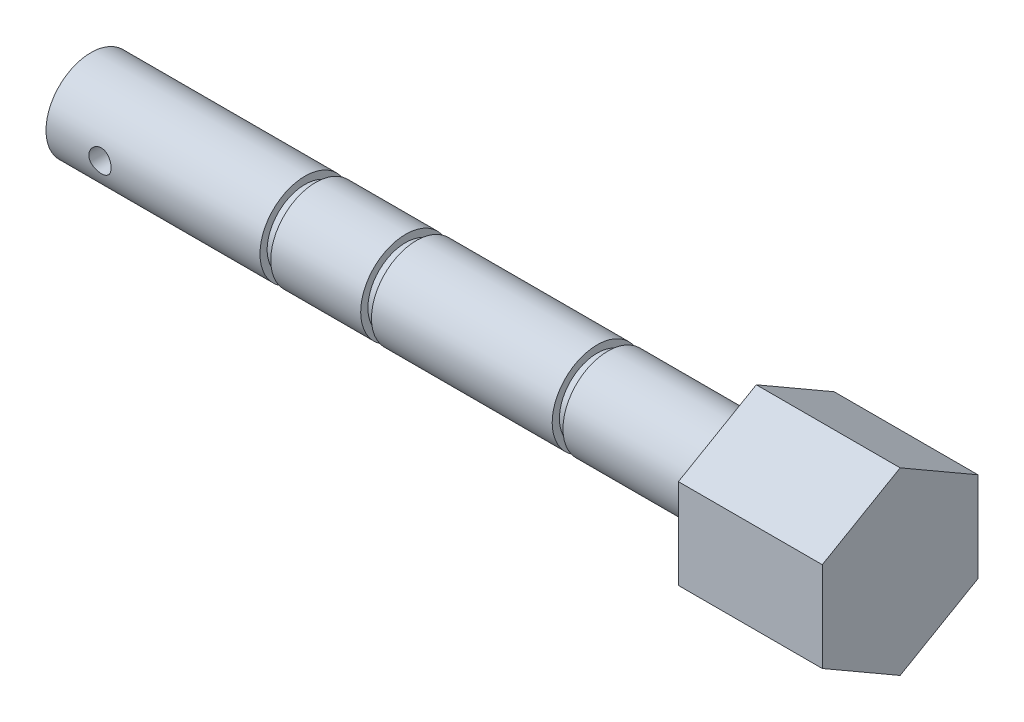
from build123d import *

# Parameters (mm, degrees)
SKETCH1_R           = 3.175
BOSS_EXTRUDE2_DEPTH = 46.99
BOSS_EXTRUDE3_DEPTH = 10.16
SKETCH3_R           = 3.175
SKETCH3_R_2         = 1.778
CUT_EXTRUDE1_DEPTH  = 19.05
SKETCH6_R           = 3.175
BOSS_EXTRUDE5_DEPTH = 49.022
CUT_EXTRUDE5_DEPTH  = 38.1
SKETCH9_R           = 0.866025404
CUT_EXTRUDE7_DEPTH  = 46.99
SKETCH10_R          = 0.7874
CUT_EXTRUDE8_DEPTH  = 5.334
CUT_EXTRUDE9_START  = 0.762
SKETCH11_R          = 3.175
SKETCH11_R_2        = 2.667
CUT_EXTRUDE9_DEPTH  = 0.762
CUT_EXTRUDE10_START = 0.762
SKETCH12_R          = 3.175
SKETCH12_R_2        = 2.667
CUT_EXTRUDE10_DEPTH = 0.762
CUT_EXTRUDE12_START = 0.762
SKETCH13_R          = 3.175
SKETCH13_R_2        = 2.667
CUT_EXTRUDE12_DEPTH = 0.762


with BuildPart() as part:
    # Sketch1 → Boss-Extrude2 (new body)
    with BuildSketch(Plane(origin=(0, 0, 0), x_dir=(0, 0, -1), z_dir=(1, 0, 0))):
        Circle(SKETCH1_R)
    extrude(amount=BOSS_EXTRUDE2_DEPTH)

    # Sketch2 → Boss-Extrude3 (add)
    with BuildSketch(Plane(origin=(46.99, 0, 0), x_dir=(0, 0, -1), z_dir=(1, 0, 0))):
        Polygon((-5.499261314, 3.175), (-5.499261314, -3.175), (0, -6.35), (5.499261314, -3.175), (5.499261314, 3.175), (0, 6.35), align=None)
    extrude(amount=BOSS_EXTRUDE3_DEPTH)

    # Sketch3 → Cut-Extrude1 (cut)
    with BuildSketch(Plane.ZY):
        Circle(SKETCH3_R)
        Circle(SKETCH3_R_2, mode=Mode.SUBTRACT)
    extrude(amount=-CUT_EXTRUDE1_DEPTH, mode=Mode.SUBTRACT)

    # Sketch6 → Boss-Extrude5 (add)
    with BuildSketch(Plane.ZY):
        Circle(SKETCH6_R)
    extrude(amount=-BOSS_EXTRUDE5_DEPTH)

    # Sketch7 → Cut-Extrude5 (cut)
    with BuildSketch(Plane.ZY):
        Polygon((-0.489261374, 0.714579112), (-0.863474351, -0.066423223), (-0.374212977, -0.781002335), (0.489261374, -0.714579112), (0.863474351, 0.066423223), (0.374212977, 0.781002335), align=None)
    extrude(amount=-CUT_EXTRUDE5_DEPTH, mode=Mode.SUBTRACT)

    # Sketch9 → Cut-Extrude7 (cut)
    with BuildSketch(Plane.ZY):
        Circle(SKETCH9_R)
    extrude(amount=-CUT_EXTRUDE7_DEPTH, mode=Mode.SUBTRACT)

    # Sketch10 → Cut-Extrude8 (cut)
    with BuildSketch(Plane.XY.offset(5.499261314)):
        with Locations((3.81, 0)):
            Circle(SKETCH10_R)
    extrude(amount=-CUT_EXTRUDE8_DEPTH, mode=Mode.SUBTRACT)

    # Sketch11 → Cut-Extrude9 (cut)
    with BuildSketch(Plane.ZY.offset(-36.5125).offset(CUT_EXTRUDE9_START)):
        Circle(SKETCH11_R)
        Circle(SKETCH11_R_2, mode=Mode.SUBTRACT)
    extrude(amount=-CUT_EXTRUDE9_DEPTH, mode=Mode.SUBTRACT)

    # Sketch12 → Cut-Extrude10 (cut)
    with BuildSketch(Plane.ZY.offset(-15.875).offset(CUT_EXTRUDE10_START)):
        Circle(SKETCH12_R)
        Circle(SKETCH12_R_2, mode=Mode.SUBTRACT)
    extrude(amount=-CUT_EXTRUDE10_DEPTH, mode=Mode.SUBTRACT)

    # Sketch13 → Cut-Extrude12 (cut)
    with BuildSketch(Plane.ZY.offset(-22.987).offset(CUT_EXTRUDE12_START)):
        Circle(SKETCH13_R)
        Circle(SKETCH13_R_2, mode=Mode.SUBTRACT)
    extrude(amount=-CUT_EXTRUDE12_DEPTH, mode=Mode.SUBTRACT)


solid = part.part
